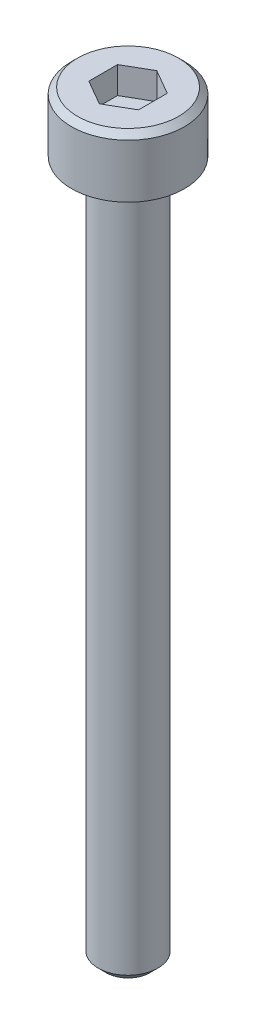
from build123d import *

# Parameters (mm, degrees)
CUT_EXTRUDE1_DEPTH = 1.35


with BuildPart() as part:
    # Sketch1 → Revolve1 (revolve)
    with BuildSketch(Plane.XY):
        Polygon((0, -35), (1.1, -35), (1.5, -34.6), (1.5, 0), (2.84, 0), (2.84, 2.7), (2.54, 3), (0, 3), align=None)
    revolve(axis=Axis((0, -10, 0), (0, 1, 0)))

    # Sketch2 → Cut-Extrude1 (cut)
    with BuildSketch(Plane(origin=(0, 3, 0), x_dir=(1, 0, 0), z_dir=(0, 1, 0))):
        Polygon((1.25, -0.721687836), (0, -1.443375673), (-1.25, -0.721687836), (-1.25, 0.721687836), (0, 1.443375673), (1.25, 0.721687836), align=None)
    extrude(amount=-CUT_EXTRUDE1_DEPTH, mode=Mode.SUBTRACT)


solid = part.part
